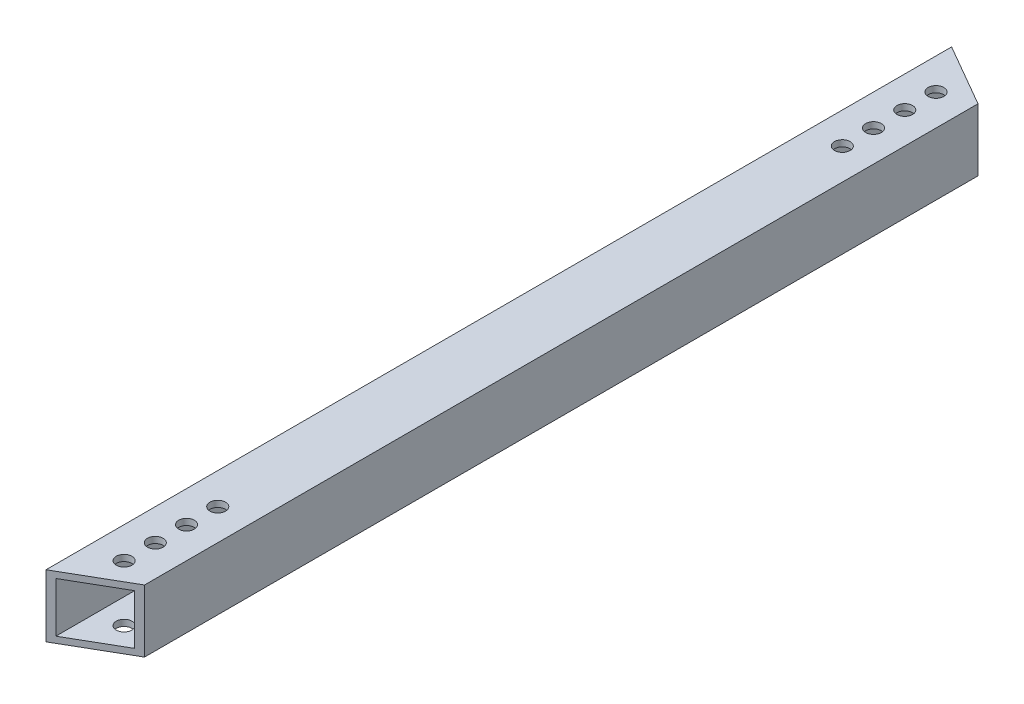
from build123d import *

# Parameters (mm, degrees)
SKETCH1_W           = 25.4
SKETCH1_H           = 25.4
SKETCH1_W_2         = 20.32
SKETCH1_H_2         = 20.32
BOSS_EXTRUDE2_DEPTH = 368.3
CUT_EXTRUDE1_DEPTH  = 370.393205135
SKETCH3_R           = 3.175
CUT_EXTRUDE2_DEPTH  = 370.393205135


with BuildPart() as part:
    # Sketch1 → Boss-Extrude2 (new body)
    with BuildSketch(Plane.XY):
        Rectangle(SKETCH1_W, SKETCH1_H)
        Rectangle(SKETCH1_W_2, SKETCH1_H_2, mode=Mode.SUBTRACT)
    extrude(amount=BOSS_EXTRUDE2_DEPTH)

    # Sketch2 → Cut-Extrude1 (cut, through all)
    with BuildSketch(Plane(origin=(0, 12.7, 0), x_dir=(1, 0, 0), z_dir=(0, 1, 0))):
        Polygon((-12.7, -368.3), (12.7, -353.635303163), (12.7, -368.3), align=None)
        Polygon((12.7, 0), (-12.7, 0), (12.7, -14.664696837), align=None)
    extrude(amount=-CUT_EXTRUDE1_DEPTH, mode=Mode.SUBTRACT)

    # Sketch3 → Cut-Extrude2 (cut, through all)
    with BuildSketch(Plane(origin=(0, 12.7, 0), x_dir=(1, 0, 0), z_dir=(0, 1, 0))):
        with Locations((0, -349.25)):
            Circle(SKETCH3_R)
        with Locations((0, -336.55)):
            Circle(SKETCH3_R)
        with Locations((0, -323.85)):
            Circle(SKETCH3_R)
        with Locations((0, -311.15)):
            Circle(SKETCH3_R)
        with Locations((0, -57.15)):
            Circle(SKETCH3_R)
        with Locations((0, -44.45)):
            Circle(SKETCH3_R)
        with Locations((0, -31.75)):
            Circle(SKETCH3_R)
        with Locations((0, -19.05)):
            Circle(SKETCH3_R)
    extrude(amount=-CUT_EXTRUDE2_DEPTH, mode=Mode.SUBTRACT)


solid = part.part
